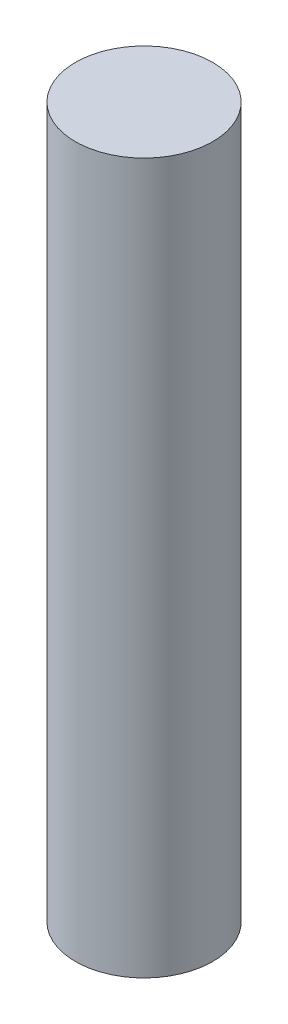
from build123d import *

# Parameters (mm, degrees)
SKETCH1_R           = 4
BOSS_EXTRUDE1_DEPTH = 20.675


with BuildPart() as part:
    # Sketch1 → Boss-Extrude1 (new, symmetric)
    with BuildSketch(Plane(origin=(0, 0, 0), x_dir=(1, 0, 0), z_dir=(0, 1, 0))):
        Circle(SKETCH1_R)
    extrude(amount=BOSS_EXTRUDE1_DEPTH, both=True)


solid = part.part
